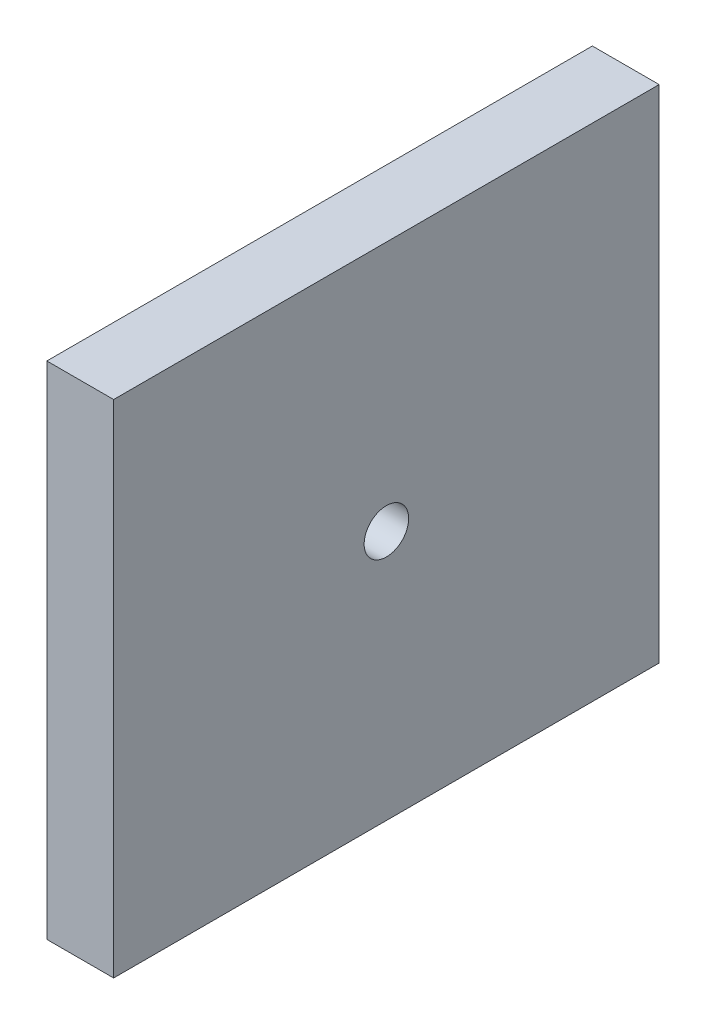
from build123d import *

# Parameters (mm, degrees)
SKETCH1_W           = 98
SKETCH1_H           = 90
BOSS_EXTRUDE1_DEPTH = 12
SKETCH2_R           = 4
CUT_EXTRUDE1_DEPTH  = 68.601775125


with BuildPart() as part:
    # Sketch1 → Boss-Extrude1 (new body)
    with BuildSketch(Plane(origin=(0, 0, 0), x_dir=(0, 0, -1), z_dir=(1, 0, 0))):
        Rectangle(SKETCH1_W, SKETCH1_H)
    extrude(amount=BOSS_EXTRUDE1_DEPTH)

    # Sketch2 → Cut-Extrude1 (cut, through all)
    with BuildSketch(Plane(origin=(12, 0, 0), x_dir=(0, 0, -1), z_dir=(1, 0, 0))):
        Circle(SKETCH2_R)
    extrude(amount=-CUT_EXTRUDE1_DEPTH, mode=Mode.SUBTRACT)


solid = part.part
